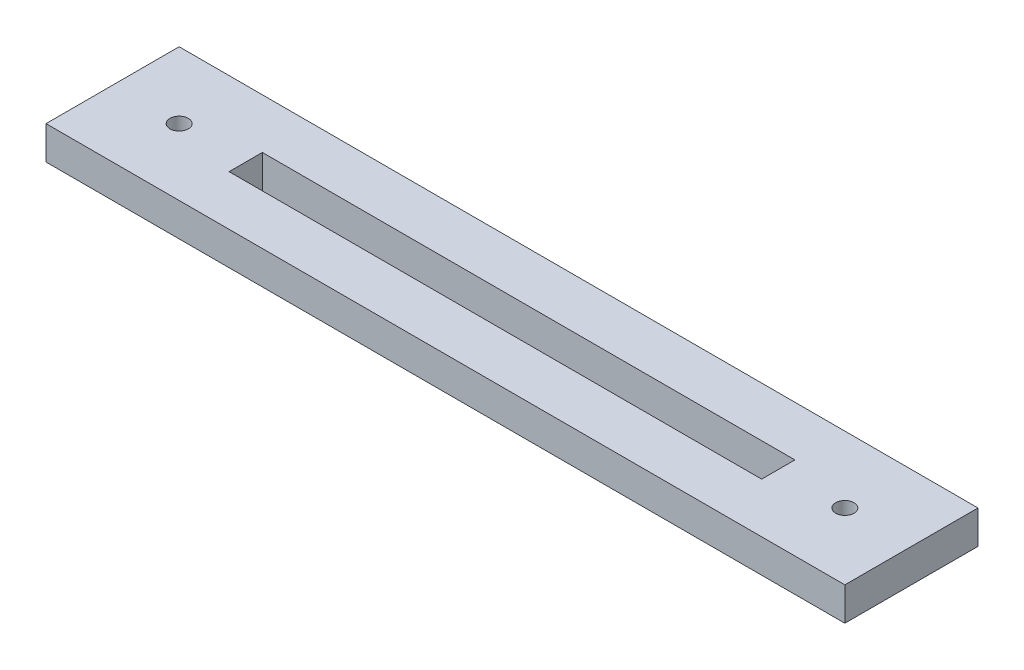
from build123d import *

# Parameters (mm, degrees)
SKETCH1_W           = 152.4
SKETCH1_H           = 25.4
SKETCH1_R           = 1.75
SKETCH1_W_2         = 101.6
SKETCH1_H_2         = 6.35
BOSS_EXTRUDE1_DEPTH = 6.35


with BuildPart() as part:
    # Sketch1 → Boss-Extrude1 (new body)
    with BuildSketch(Plane(origin=(0, 0, 0), x_dir=(1, 0, 0), z_dir=(0, 1, 0))):
        Rectangle(SKETCH1_W, SKETCH1_H)
        with Locations((63.5, 0)):
            Circle(SKETCH1_R, mode=Mode.SUBTRACT)
        with Locations((-63.5, 0)):
            Circle(SKETCH1_R, mode=Mode.SUBTRACT)
        Rectangle(SKETCH1_W_2, SKETCH1_H_2, mode=Mode.SUBTRACT)
    extrude(amount=BOSS_EXTRUDE1_DEPTH)


solid = part.part
